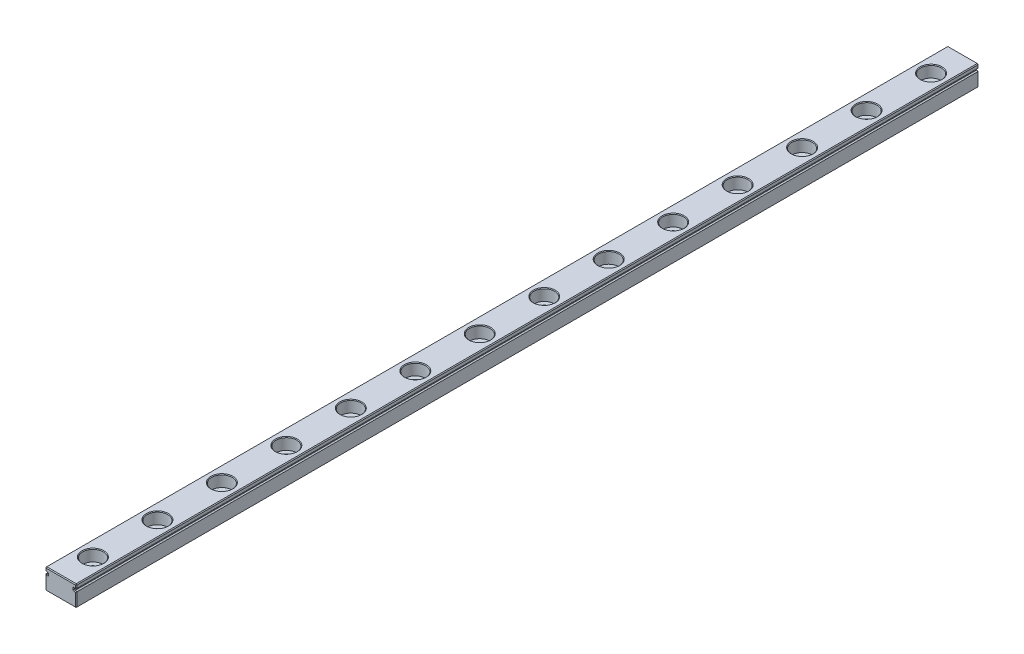
from build123d import *

# Parameters (mm, degrees)
BOSS_EXTRUDE1_DEPTH = 350
CHAMFER1_SIZE       = 0.3
LPATTERN1_COUNT     = 14
LPATTERN1_PITCH     = 25


with BuildPart() as part:
    # Sketch1 → Boss-Extrude1 (new body)
    with BuildSketch(Plane.XY):
        with BuildLine():
            Line((0, 8), (12, 8))
            Line((12, 8), (12, 6.75))
            Line((12, 6.75), (12, 6.559016994))
            ThreePointArc((12, 6.559016994), (11.706107374, 6.475528258), (11.5, 6.25))
            Line((11.5, 6.25), (11, 6.25))
            Line((11, 6.25), (11, 5.75))
            Line((11, 5.75), (11.5, 5.75))
            ThreePointArc((11.5, 5.75), (11.706107374, 5.524471742), (12, 5.440983006))
            Line((12, 5.440983006), (12, 5.25))
            Line((12, 5.25), (12, 0))
            Line((12, 0), (0, 0))
            Line((0, 0), (0, 5.25))
            Line((0, 5.25), (0, 5.440983006))
            ThreePointArc((0, 5.440983006), (0.293892626, 5.524471742), (0.5, 5.75))
            Line((0.5, 5.75), (1, 5.75))
            Line((1, 5.75), (1, 6.25))
            Line((1, 6.25), (0.5, 6.25))
            ThreePointArc((0.5, 6.25), (0.293892626, 6.475528258), (0, 6.559016994))
            Line((0, 6.559016994), (0, 6.75))
            Line((0, 6.75), (0, 8))
        make_face()
    extrude(amount=BOSS_EXTRUDE1_DEPTH)

    # Chamfer1
    chamfer1_edges = [part.edges().sort_by_distance(p)[0] for p in [
        (0, 0, 175),
        (12, 0, 175),
        (0, 8, 175),
        (12, 8, 175),
        (0.293892626, 5.524471742, 350),
        (0.75, 5.75, 350),
        (1, 6, 350),
        (0.75, 6.25, 350),
        (0.293892626, 6.475528258, 350),
        (0, 7.279508497, 350),
        (6, 8, 350),
        (12, 7.279508497, 350),
        (11.706107374, 6.475528258, 350),
        (11.25, 6.25, 350),
        (11, 6, 350),
        (11.25, 5.75, 350),
        (11.706107374, 5.524471742, 350),
        (12, 2.720491503, 350),
        (6, 0, 350),
        (0, 2.720491503, 350),
        (12, 2.720491503, 0),
        (11.706107374, 5.524471742, 0),
        (11.25, 5.75, 0),
        (11, 6, 0),
        (11.25, 6.25, 0),
        (11.706107374, 6.475528258, 0),
        (12, 7.279508497, 0),
        (6, 0, 0),
        (0, 2.720491503, 0),
        (0.293892626, 5.524471742, 0),
        (0.75, 5.75, 0),
        (1, 6, 0),
        (0.75, 6.25, 0),
        (0.293892626, 6.475528258, 0),
        (0, 7.279508497, 0),
        (6, 8, 0),
    ]]
    chamfer(chamfer1_edges, length=CHAMFER1_SIZE)

    # Sketch3 → CBORE for M5 Hex Head Bolt1 (revolve, cut)
    with BuildSketch(Plane(origin=(6, 8, 12.5), x_dir=(0, 0, 1), z_dir=(1, 0, 0))):
        Polygon((0, 0), (0, 8), (2.5, 8), (2.25, 7.75), (2.25, 4.5), (4, 4.5), (4, 0.25), (4.25, 0), align=None)
    cbore_for_m5_hex_head_bolt1 = revolve(axis=Axis((6, 14.35, 12.5), (0, -1, 0)), mode=Mode.SUBTRACT)

    # LPattern1: CBORE for M5 Hex Head Bolt1 ×14
    with Locations(*[(0, 0, i * LPATTERN1_PITCH) for i in range(1, LPATTERN1_COUNT)]):
        add(cbore_for_m5_hex_head_bolt1, mode=Mode.SUBTRACT)


solid = part.part
